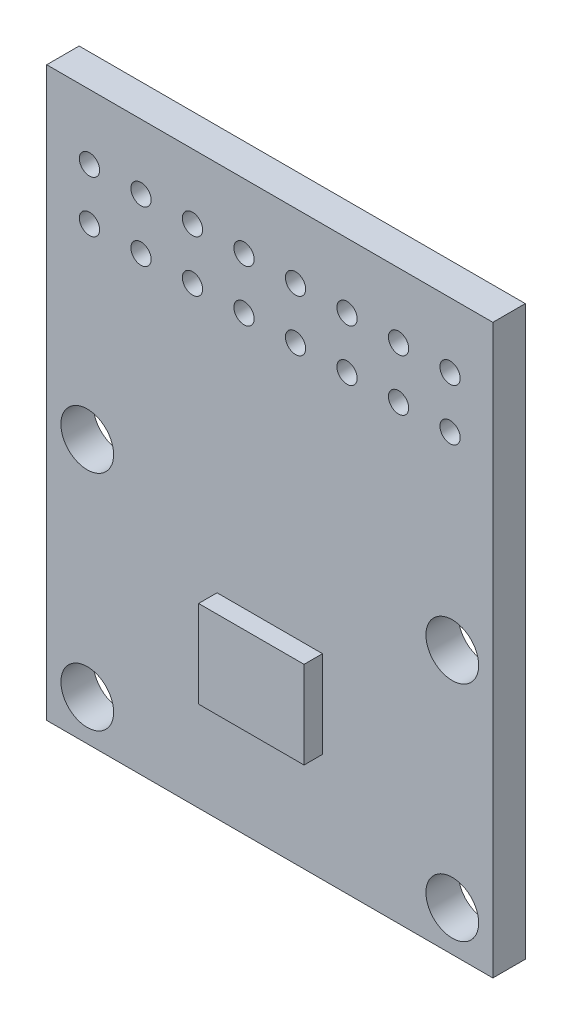
from build123d import *

# Parameters (mm, degrees)
SKETCH_1_W      = 22
SKETCH_1_H      = 28
SKETCH_1_R      = 1.3
SKETCH_1_R_2    = 0.5
EXTRUDE_1_DEPTH = 1.6
SKETCH_2_W      = 5.2
SKETCH_2_H      = 4.3
EXTRUDE_2_DEPTH = 0.91


with BuildPart() as part:
    # 草图1 → 凸台-拉伸1 (new body)
    with BuildSketch(Plane.XY):
        Rectangle(SKETCH_1_W, SKETCH_1_H)
        with Locations((-9, -1)):
            Circle(SKETCH_1_R, mode=Mode.SUBTRACT)
        with Locations((-9, -12)):
            Circle(SKETCH_1_R, mode=Mode.SUBTRACT)
        with Locations((9, -12)):
            Circle(SKETCH_1_R, mode=Mode.SUBTRACT)
        with Locations((9, -1)):
            Circle(SKETCH_1_R, mode=Mode.SUBTRACT)
        with Locations((-8.89, 10.8)):
            Circle(SKETCH_1_R_2, mode=Mode.SUBTRACT)
        with Locations((-6.35, 10.8)):
            Circle(SKETCH_1_R_2, mode=Mode.SUBTRACT)
        with Locations((-3.81, 10.8)):
            Circle(SKETCH_1_R_2, mode=Mode.SUBTRACT)
        with Locations((-1.27, 10.8)):
            Circle(SKETCH_1_R_2, mode=Mode.SUBTRACT)
        with Locations((1.27, 10.8)):
            Circle(SKETCH_1_R_2, mode=Mode.SUBTRACT)
        with Locations((3.81, 10.8)):
            Circle(SKETCH_1_R_2, mode=Mode.SUBTRACT)
        with Locations((6.35, 10.8)):
            Circle(SKETCH_1_R_2, mode=Mode.SUBTRACT)
        with Locations((8.89, 10.8)):
            Circle(SKETCH_1_R_2, mode=Mode.SUBTRACT)
        with Locations((-6.35, 8.26)):
            Circle(SKETCH_1_R_2, mode=Mode.SUBTRACT)
        with Locations((-3.81, 8.26)):
            Circle(SKETCH_1_R_2, mode=Mode.SUBTRACT)
        with Locations((-1.27, 8.26)):
            Circle(SKETCH_1_R_2, mode=Mode.SUBTRACT)
        with Locations((1.27, 8.26)):
            Circle(SKETCH_1_R_2, mode=Mode.SUBTRACT)
        with Locations((3.81, 8.26)):
            Circle(SKETCH_1_R_2, mode=Mode.SUBTRACT)
        with Locations((6.35, 8.26)):
            Circle(SKETCH_1_R_2, mode=Mode.SUBTRACT)
        with Locations((8.89, 8.26)):
            Circle(SKETCH_1_R_2, mode=Mode.SUBTRACT)
        with Locations((-8.89, 8.26)):
            Circle(SKETCH_1_R_2, mode=Mode.SUBTRACT)
    extrude(amount=EXTRUDE_1_DEPTH)

    # 草图2 → 凸台-拉伸2 (add)
    with BuildSketch(Plane.XY.offset(1.6)):
        with Locations((0, -6.5)):
            Rectangle(SKETCH_2_W, SKETCH_2_H)
    extrude(amount=EXTRUDE_2_DEPTH)


solid = part.part
